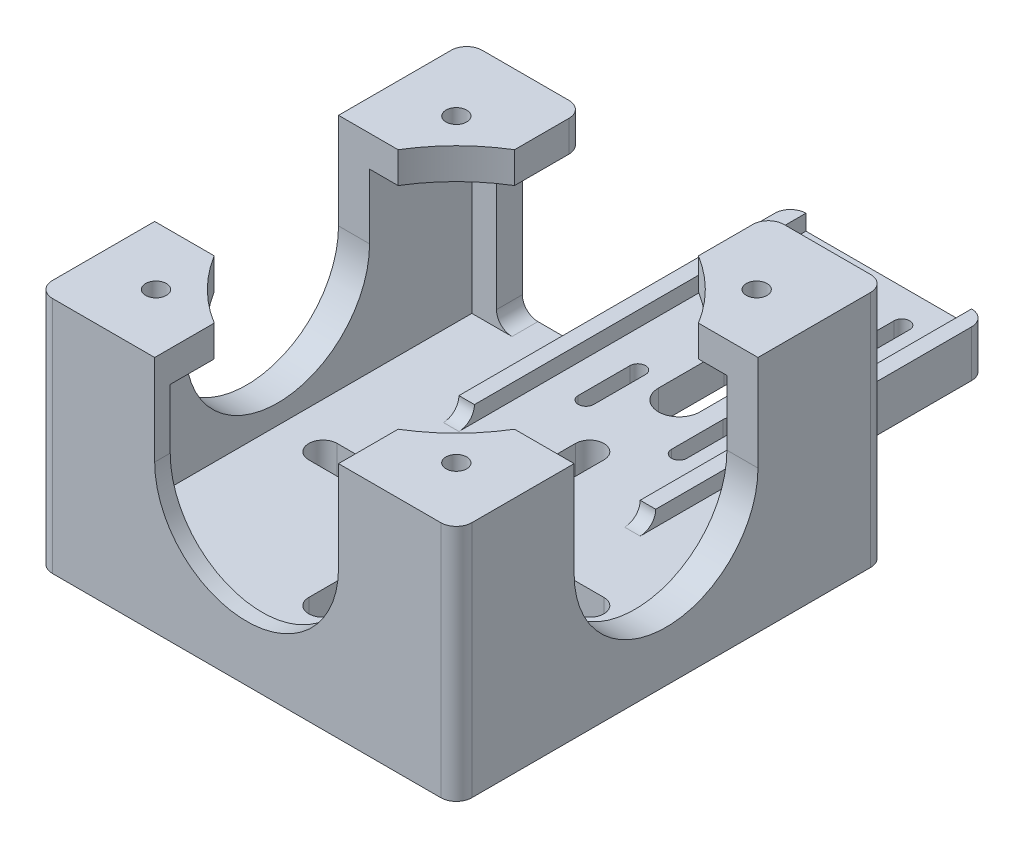
from build123d import *

# Parameters (mm, degrees)
SKETCH1_W            = 75
SKETCH1_H            = 6
BOSS_EXTRUDE1_DEPTH  = 75
CUT_EXTRUDE1_REACH   = 100.149
SKETCH2_R            = 2
CUT_EXTRUDE2_REACH   = 100.149
SKETCH3_R            = 3
BOSS_EXTRUDE5_DEPTH  = 6
CUT_EXTRUDE3_REACH   = 138.562
SKETCH14_W           = 3
SKETCH14_H           = 3
BOSS_EXTRUDE6_DEPTH  = 64
SKETCH15_W           = 81
SKETCH15_H           = 46
BOSS_EXTRUDE7_DEPTH  = 3
FILLET6_R            = 3
FILLET7_R            = 3
FILLET9_R            = 3
FILLET10_R           = 3
FILLET11_R           = 3
FILLET12_R           = 3
SKETCH22_W           = 6
SKETCH22_H           = 34
BOSS_EXTRUDE9_DEPTH  = 75
FILLET13_R           = 3
CUT_EXTRUDE8_REACH   = 138.562
CUT_EXTRUDE10_DEPTH  = 152.825557796
CUT_EXTRUDE11_DEPTH  = 139.265143836
BOSS_EXTRUDE12_DEPTH = 5
FILLET28_R           = 3
FILLET29_R           = 3
FILLET30_R           = 3
FILLET31_R           = 3
FILLET32_R           = 3
FILLET33_R           = 3


with BuildPart() as part:
    # Sketch1 → Boss-Extrude1 (new body)
    with BuildSketch(Plane.XY):
        Polygon((-37.5, 37), (37.5, 37), (43.5, 37), (43.5, 43), (-37.5, 43), align=None)
        Polygon((37.5, 37), (37.5, 3), (37.5, -3), (43.5, -3), (43.5, 37), align=None)
        Rectangle(SKETCH1_W, SKETCH1_H)
    extrude(amount=-BOSS_EXTRUDE1_DEPTH)

    # Sketch2 → Cut-Extrude1 (cut, up to next)
    with BuildSketch(Plane(origin=(0, 43, 0), x_dir=(1, 0, 0), z_dir=(0, 1, 0)), mode=Mode.PRIVATE) as cut_extrude1_sk1:
        with Locations(Location((-26, 8.5, 0), (0, 0, 270))):
            Circle(SKETCH2_R)
    cut_extrude1_tool1 = extrude(cut_extrude1_sk1.sketch, amount=-CUT_EXTRUDE1_REACH, mode=Mode.PRIVATE) & part.part
    # Sketch2 → Cut-Extrude1 (cut, up to next)
    with BuildSketch(Plane(origin=(0, 43, 0), x_dir=(1, 0, 0), z_dir=(0, 1, 0)), mode=Mode.PRIVATE) as cut_extrude1_sk2:
        with BuildLine():
            ThreePointArc((-26, 19.751760651), (-21.04163056, 13.45836944), (-14.748239349, 8.5))
            Line((-14.748239349, 8.5), (20.748239349, 8.5))
            ThreePointArc((20.748239349, 8.5), (27.04163056, 13.45836944), (32, 19.751760651))
            Line((32, 19.751760651), (32, 55.248239349))
            ThreePointArc((32, 55.248239349), (27.04163056, 61.54163056), (20.748239349, 66.5))
            Line((20.748239349, 66.5), (-14.748239349, 66.5))
            ThreePointArc((-14.748239349, 66.5), (-21.04163056, 61.54163056), (-26, 55.248239349))
            Line((-26, 55.248239349), (-26, 19.751760651))
        make_face()
    cut_extrude1_tool2 = extrude(cut_extrude1_sk2.sketch, amount=-CUT_EXTRUDE1_REACH, mode=Mode.PRIVATE) & part.part
    # Sketch2 → Cut-Extrude1 (cut, up to next)
    with BuildSketch(Plane(origin=(0, 43, 0), x_dir=(1, 0, 0), z_dir=(0, 1, 0)), mode=Mode.PRIVATE) as cut_extrude1_sk3:
        with Locations(Location((32, 8.5, 0), (0, 0, 270))):
            Circle(SKETCH2_R)
    cut_extrude1_tool3 = extrude(cut_extrude1_sk3.sketch, amount=-CUT_EXTRUDE1_REACH, mode=Mode.PRIVATE) & part.part
    # Sketch2 → Cut-Extrude1 (cut, up to next)
    with BuildSketch(Plane(origin=(0, 43, 0), x_dir=(1, 0, 0), z_dir=(0, 1, 0)), mode=Mode.PRIVATE) as cut_extrude1_sk4:
        with Locations(Location((-26, 66.5, 0), (0, 0, 270))):
            Circle(SKETCH2_R)
    cut_extrude1_tool4 = extrude(cut_extrude1_sk4.sketch, amount=-CUT_EXTRUDE1_REACH, mode=Mode.PRIVATE) & part.part
    # Sketch2 → Cut-Extrude1 (cut, up to next)
    with BuildSketch(Plane(origin=(0, 43, 0), x_dir=(1, 0, 0), z_dir=(0, 1, 0)), mode=Mode.PRIVATE) as cut_extrude1_sk5:
        with Locations(Location((32, 66.5, 0), (0, 0, 270))):
            Circle(SKETCH2_R)
    cut_extrude1_tool5 = extrude(cut_extrude1_sk5.sketch, amount=-CUT_EXTRUDE1_REACH, mode=Mode.PRIVATE) & part.part
    add(cut_extrude1_tool1.solids().sort_by_distance((-26, 43, -8.5))[0], mode=Mode.SUBTRACT)
    add(cut_extrude1_tool2.solids().sort_by_distance((3, 43, -37.5))[0], mode=Mode.SUBTRACT)
    add(cut_extrude1_tool3.solids().sort_by_distance((32, 43, -8.5))[0], mode=Mode.SUBTRACT)
    add(cut_extrude1_tool4.solids().sort_by_distance((-26, 43, -66.5))[0], mode=Mode.SUBTRACT)
    add(cut_extrude1_tool5.solids().sort_by_distance((32, 43, -66.5))[0], mode=Mode.SUBTRACT)

    # Sketch3 → Cut-Extrude2 (cut, up to next)
    with BuildSketch(Plane.XZ.offset(3), mode=Mode.PRIVATE) as cut_extrude2_sk1:
        with Locations((3, -37.5)):
            Circle(SKETCH3_R)
    cut_extrude2_tool1 = extrude(cut_extrude2_sk1.sketch, amount=-CUT_EXTRUDE2_REACH, mode=Mode.PRIVATE) & part.part
    add(cut_extrude2_tool1.solids().sort_by_distance((3, -3, -37.5))[0], mode=Mode.SUBTRACT)

    # Sketch11 → Boss-Extrude5 (add)
    # profile 1 of 3: a face of its own
    with BuildSketch(Plane.XZ.offset(3)):
        with BuildLine():
            Line((-1, -93.222045862), (-1, -80.538706378))
            Line((-1, -80.538706378), (-4.5, -80.538706378))
            Line((-4.5, -80.538706378), (-4.5, -81.538706378))
            ThreePointArc((-4.5, -81.538706378), (-6, -83.038706378), (-7.5, -81.538706378))
            Line((-7.5, -81.538706378), (-7.5, -75))
            Line((-7.5, -75), (-16, -75))
            Line((-16, -75), (-16, -121))
            Line((-16, -121), (3, -121))
            Line((3, -121), (3, -97.222045862))
            ThreePointArc((3, -97.222045862), (0.171572875, -96.050472986), (-1, -93.222045862))
        make_face()
        with BuildLine():
            ThreePointArc((-7.5, -104.538706378), (-6, -103.038706378), (-4.5, -104.538706378))
            Line((-4.5, -104.538706378), (-4.5, -114.538706378))
            ThreePointArc((-4.5, -114.538706378), (-6, -116.038706378), (-7.5, -114.538706378))
            Line((-7.5, -114.538706378), (-7.5, -104.538706378))
        make_face(mode=Mode.SUBTRACT)
    # profile 2 of 3: a face of its own
    with BuildSketch(Plane.XZ.offset(3)):
        with BuildLine():
            Line((10.5, -75), (3, -75))
            Line((3, -75), (3, -76.538706378))
            ThreePointArc((3, -76.538706378), (5.828427125, -77.710279254), (7, -80.538706378))
            Line((7, -80.538706378), (7, -93.222045862))
            ThreePointArc((7, -93.222045862), (5.828427125, -96.050472986), (3, -97.222045862))
            Line((3, -97.222045862), (3, -121))
            Line((3, -121), (22, -121))
            Line((22, -121), (22, -75))
            Line((22, -75), (13.5, -75))
            Line((13.5, -75), (13.5, -81.538706378))
            ThreePointArc((13.5, -81.538706378), (12, -83.038706378), (10.5, -81.538706378))
            Line((10.5, -81.538706378), (10.5, -75))
        make_face()
        with BuildLine():
            Line((10.5, -114.538706378), (10.5, -104.538706378))
            ThreePointArc((10.5, -104.538706378), (12, -103.038706378), (13.5, -104.538706378))
            Line((13.5, -104.538706378), (13.5, -114.538706378))
            ThreePointArc((13.5, -114.538706378), (12, -116.038706378), (10.5, -114.538706378))
        make_face(mode=Mode.SUBTRACT)
    # profile 3 of 3: a face of its own
    with BuildSketch(Plane.XZ.offset(3)):
        with BuildLine():
            Line((3, -76.538706378), (3, -75))
            Line((3, -75), (-4.5, -75))
            Line((-4.5, -75), (-4.5, -80.538706378))
            Line((-4.5, -80.538706378), (-1, -80.538706378))
            ThreePointArc((-1, -80.538706378), (0.171572875, -77.710279254), (3, -76.538706378))
        make_face()
    extrude(amount=-BOSS_EXTRUDE5_DEPTH)

    # Sketch12 → Cut-Extrude3 (cut, up to next)
    with BuildSketch(Plane.XZ.offset(3), mode=Mode.PRIVATE) as cut_extrude3_sk1:
        with BuildLine():
            Line((-7.5, -81.538706378), (-7.5, -71.538706378))
            ThreePointArc((-7.5, -71.538706378), (-6, -70.038706378), (-4.5, -71.538706378))
            Line((-4.5, -71.538706378), (-4.5, -81.538706378))
            ThreePointArc((-4.5, -81.538706378), (-6, -83.038706378), (-7.5, -81.538706378))
        make_face()
    cut_extrude3_tool1 = extrude(cut_extrude3_sk1.sketch, amount=-CUT_EXTRUDE3_REACH, mode=Mode.PRIVATE) & part.part
    # Sketch12 → Cut-Extrude3 (cut, up to next)
    with BuildSketch(Plane.XZ.offset(3), mode=Mode.PRIVATE) as cut_extrude3_sk2:
        with BuildLine():
            Line((13.5, -81.538706378), (13.5, -71.538706378))
            ThreePointArc((13.5, -71.538706378), (12, -70.038706378), (10.5, -71.538706378))
            Line((10.5, -71.538706378), (10.5, -81.538706378))
            ThreePointArc((10.5, -81.538706378), (12, -83.038706378), (13.5, -81.538706378))
        make_face()
    cut_extrude3_tool2 = extrude(cut_extrude3_sk2.sketch, amount=-CUT_EXTRUDE3_REACH, mode=Mode.PRIVATE) & part.part
    add(cut_extrude3_tool1.solids().sort_by_distance((-6, -3, -76.538706))[0], mode=Mode.SUBTRACT)
    add(cut_extrude3_tool2.solids().sort_by_distance((12, -3, -76.538706))[0], mode=Mode.SUBTRACT)

    # Sketch14 → Boss-Extrude6 (add)
    with BuildSketch(Plane(origin=(0, 0, -121), x_dir=(-1, 0, 0), z_dir=(0, 0, -1))):
        with Locations((-20.5, 4.5)):
            Rectangle(SKETCH14_W, SKETCH14_H)
        with Locations((14.5, 4.5)):
            Rectangle(SKETCH14_W, SKETCH14_H)
    extrude(amount=-BOSS_EXTRUDE6_DEPTH)

    # Sketch15 → Boss-Extrude7 (add)
    with BuildSketch(Plane.XY):
        with Locations((3, 20)):
            Rectangle(SKETCH15_W, SKETCH15_H)
    extrude(amount=BOSS_EXTRUDE7_DEPTH)

    # Fillet6
    fillet6_edges = [part.edges().sort_by_distance(p)[0] for p in [
        (43.5, 20, 3),
    ]]
    fillet(fillet6_edges, radius=FILLET6_R)

    # Fillet7
    fillet7_edges = [part.edges().sort_by_distance(p)[0] for p in [
        (-37.5, 20, 3),
    ]]
    fillet(fillet7_edges, radius=FILLET7_R - 0.0001)  # a hair under: the kernel refuses the full size

    # Fillet9
    fillet9_edges = [part.edges().sort_by_distance(p)[0] for p in [
        (22, 1.5, -121),
    ]]
    fillet(fillet9_edges, radius=FILLET9_R)

    # Fillet10
    fillet10_edges = [part.edges().sort_by_distance(p)[0] for p in [
        (-16, 1.5, -121),
    ]]
    fillet(fillet10_edges, radius=FILLET10_R - 0.0001)  # a hair under: the kernel refuses the full size

    # Fillet11
    fillet11_edges = [part.edges().sort_by_distance(p)[0] for p in [
        (-14.5, 3, -57),
    ]]
    fillet(fillet11_edges, radius=FILLET11_R - 0.0001)  # a hair under: the kernel refuses the full size

    # Fillet12
    fillet12_edges = [part.edges().sort_by_distance(p)[0] for p in [
        (20.5, 3, -57),
    ]]
    fillet(fillet12_edges, radius=FILLET12_R - 0.0001)  # a hair under: the kernel refuses the full size

    # Sketch22 → Boss-Extrude9 (add)
    with BuildSketch(Plane(origin=(0, 0, 0), x_dir=(-1, 0, 0), z_dir=(0, 0, -1))):
        with Locations((34.5, 20)):
            Rectangle(SKETCH22_W, SKETCH22_H)
    extrude(amount=BOSS_EXTRUDE9_DEPTH)

    # Fillet13
    fillet13_edges = [part.edges().sort_by_distance(p)[0] for p in [
        (3, 3, 0),
    ]]
    fillet(fillet13_edges, radius=FILLET13_R)

    # Sketch26 → Cut-Extrude8 (cut, up to next)
    with BuildSketch(Plane.XZ.offset(3), mode=Mode.PRIVATE) as cut_extrude8_sk1:
        with BuildLine():
            Line((5.749072371, -50.792900192), (5.749072371, -63.245806186))
            ThreePointArc((5.749072371, -63.245806186), (3, -65.994878557), (0.250927629, -63.245806186))
            Line((0.250927629, -63.245806186), (0.250927629, -50.792900192))
            ThreePointArc((0.250927629, -50.792900192), (3, -48.043827821), (5.749072371, -50.792900192))
        make_face()
    cut_extrude8_tool1 = extrude(cut_extrude8_sk1.sketch, amount=-CUT_EXTRUDE8_REACH, mode=Mode.PRIVATE) & part.part
    # Sketch26 → Cut-Extrude8 (cut, up to next)
    with BuildSketch(Plane.XZ.offset(3), mode=Mode.PRIVATE) as cut_extrude8_sk2:
        with BuildLine():
            Line((-10.292900192, -40.249072371), (-22.745806186, -40.249072371))
            ThreePointArc((-22.745806186, -40.249072371), (-25.494878557, -37.5), (-22.745806186, -34.750927629))
            Line((-22.745806186, -34.750927629), (-10.292900192, -34.750927629))
            ThreePointArc((-10.292900192, -34.750927629), (-7.543827821, -37.5), (-10.292900192, -40.249072371))
        make_face()
    cut_extrude8_tool2 = extrude(cut_extrude8_sk2.sketch, amount=-CUT_EXTRUDE8_REACH, mode=Mode.PRIVATE) & part.part
    # Sketch26 → Cut-Extrude8 (cut, up to next)
    with BuildSketch(Plane.XZ.offset(3), mode=Mode.PRIVATE) as cut_extrude8_sk3:
        with BuildLine():
            Line((0.250927629, -24.207099808), (0.250927629, -11.754193814))
            ThreePointArc((0.250927629, -11.754193814), (3, -9.005121443), (5.749072371, -11.754193814))
            Line((5.749072371, -11.754193814), (5.749072371, -24.207099808))
            ThreePointArc((5.749072371, -24.207099808), (3, -26.956172179), (0.250927629, -24.207099808))
        make_face()
    cut_extrude8_tool3 = extrude(cut_extrude8_sk3.sketch, amount=-CUT_EXTRUDE8_REACH, mode=Mode.PRIVATE) & part.part
    # Sketch26 → Cut-Extrude8 (cut, up to next)
    with BuildSketch(Plane.XZ.offset(3), mode=Mode.PRIVATE) as cut_extrude8_sk4:
        with BuildLine():
            Line((16.292900192, -34.750927629), (28.745806186, -34.750927629))
            ThreePointArc((28.745806186, -34.750927629), (31.494878557, -37.5), (28.745806186, -40.249072371))
            Line((28.745806186, -40.249072371), (16.292900192, -40.249072371))
            ThreePointArc((16.292900192, -40.249072371), (13.543827821, -37.5), (16.292900192, -34.750927629))
        make_face()
    cut_extrude8_tool4 = extrude(cut_extrude8_sk4.sketch, amount=-CUT_EXTRUDE8_REACH, mode=Mode.PRIVATE) & part.part
    add(cut_extrude8_tool1.solids().sort_by_distance((3, -3, -57.019353))[0], mode=Mode.SUBTRACT)
    add(cut_extrude8_tool2.solids().sort_by_distance((-16.519353, -3, -37.5))[0], mode=Mode.SUBTRACT)
    add(cut_extrude8_tool3.solids().sort_by_distance((3, -3, -17.980647))[0], mode=Mode.SUBTRACT)
    add(cut_extrude8_tool4.solids().sort_by_distance((22.519353, -3, -37.5))[0], mode=Mode.SUBTRACT)

    # Sketch30 → Cut-Extrude10 (cut, through all)
    with BuildSketch(Plane.ZY.offset(37.5)):
        with BuildLine():
            Line((-19.75, 61.5), (-19.75, 24.5))
            ThreePointArc((-19.75, 24.5), (-37.5, 6.75), (-55.25, 24.5))
            Line((-55.25, 24.5), (-55.25, 61.5))
            ThreePointArc((-55.25, 61.5), (-37.5, 79.25), (-19.75, 61.5))
        make_face()
    extrude(amount=-CUT_EXTRUDE10_DEPTH, mode=Mode.SUBTRACT)

    # Sketch31 → Cut-Extrude11 (cut, through all)
    with BuildSketch(Plane.XY.offset(3)):
        with BuildLine():
            Line((20.75, 60.5), (20.75, 25.5))
            ThreePointArc((20.75, 25.5), (3, 7.75), (-14.75, 25.5))
            Line((-14.75, 25.5), (-14.75, 60.5))
            ThreePointArc((-14.75, 60.5), (3, 78.25), (20.75, 60.5))
        make_face()
    extrude(amount=-CUT_EXTRUDE11_DEPTH, mode=Mode.SUBTRACT)

    # Sketch35 → Boss-Extrude12 (add)
    with BuildSketch(Plane(origin=(0, 0, -75), x_dir=(-1, 0, 0), z_dir=(0, 0, -1))):
        Polygon((-20.75, 37), (-20.75, 43), (-43.5, 43), (-43.5, -3), (-22, -3), (-22, 3), (-32.75, 3), (-32.75, 37), align=None)
        Polygon((26.75, 3), (26.75, 37), (14.75, 37), (14.75, 43), (37.5, 43), (37.5, -3), (16, -3), (16, 3), align=None)
    extrude(amount=BOSS_EXTRUDE12_DEPTH)

    # Fillet28
    fillet28_edges = [part.edges().sort_by_distance(p)[0] for p in [
        (-37.5, 20, -80),
    ]]
    fillet(fillet28_edges, radius=FILLET28_R)

    # Fillet29
    fillet29_edges = [part.edges().sort_by_distance(p)[0] for p in [
        (43.5, 20, -80),
    ]]
    fillet(fillet29_edges, radius=FILLET29_R)

    # Fillet30
    fillet30_edges = [part.edges().sort_by_distance(p)[0] for p in [
        (20.75, 40, -80),
    ]]
    fillet(fillet30_edges, radius=FILLET30_R)

    # Fillet31
    fillet31_edges = [part.edges().sort_by_distance(p)[0] for p in [
        (-14.75, 40, -80),
    ]]
    fillet(fillet31_edges, radius=FILLET31_R)

    # Fillet32
    fillet32_edges = [part.edges().sort_by_distance(p)[0] for p in [
        (-26.75, 3, -77.5),
    ]]
    fillet(fillet32_edges, radius=FILLET32_R)

    # Fillet33
    fillet33_edges = [part.edges().sort_by_distance(p)[0] for p in [
        (32.75, 3, -77.5),
    ]]
    fillet(fillet33_edges, radius=FILLET33_R)


solid = part.part
